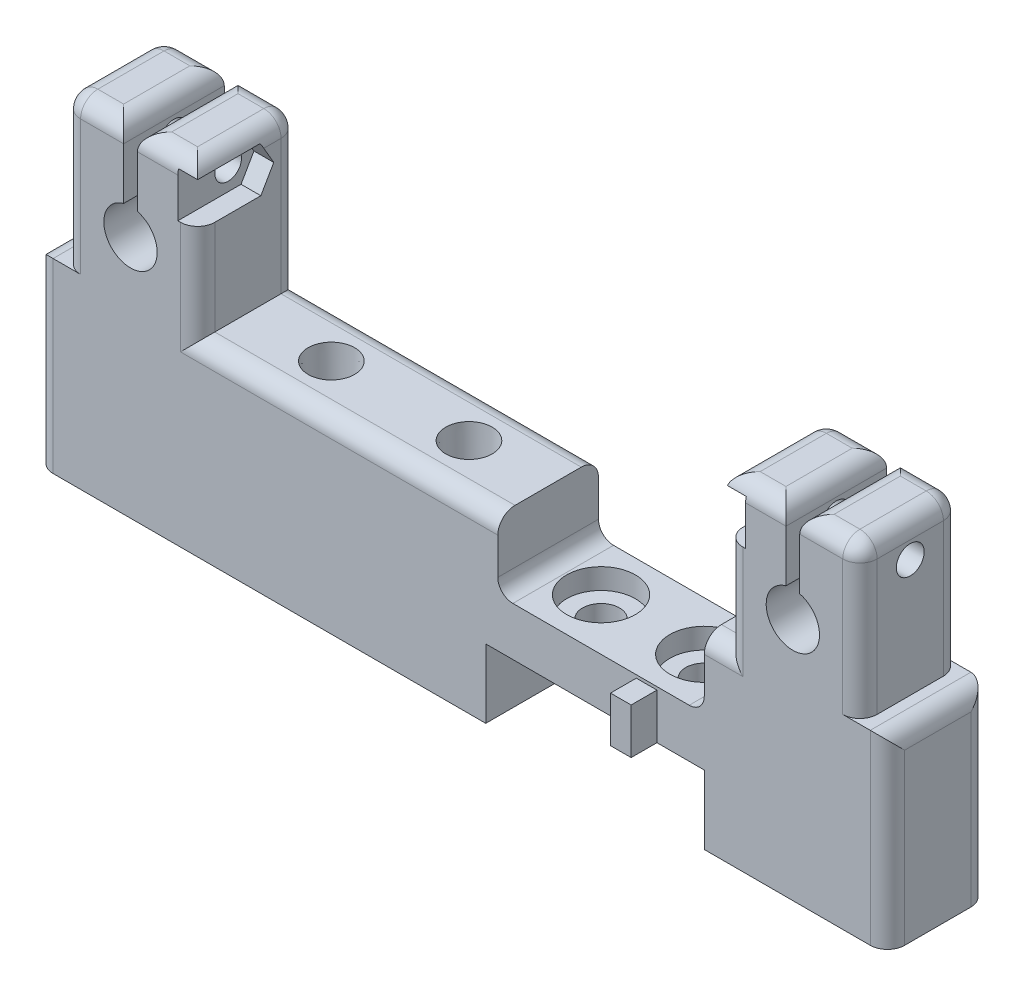
from build123d import *
from OCP.BRepFilletAPI import BRepFilletAPI_MakeChamfer
from build123d.topology import SkipClean

# Parameters (mm, degrees)
SKETCH1_R                      = 3.1
SKETCH1_R_2                    = 3.5
SKETCH1_W                      = 32
SKETCH1_H                      = 15.65
BOSS_EXTRUDE1_DEPTH            = 11.7
CUT_EXTRUDE5_DEPTH             = 14
CUT_EXTRUDE8_REACH             = 96.23
SKETCH10_R                     = 1.55
CUT_EXTRUDE8_DIRECTION_2_REACH = 96.23
CUT_EXTRUDE9_REACH             = 94.724
SKETCH11_R                     = 1.625
CUT_EXTRUDE9_DIRECTION_2_REACH = 94.724
CUT_EXTRUDE10_DEPTH            = 2.3
CUT_EXTRUDE11_DEPTH            = 2.3
HOLE1_D                        = 4.8
HOLE1_DEPTH                    = 12
HOLE1_CBORE_D                  = 5.4
HOLE1_CBORE_DEPTH              = 6
CUT_EXTRUDE17_REACH            = 66.001
SKETCH30_W                     = 59.4
SKETCH30_H                     = 25.65
SKETCH32_W                     = 99
SKETCH32_H                     = 8
CUT_EXTRUDE20_DEPTH            = 65.000566
CHAMFER1_SIZE                  = 6
CHAMFER1_SIZE_2                = 0.3
FILLET1_R                      = 2
SKETCH33_W                     = 2.4
SKETCH33_H                     = 5.3
BOSS_EXTRUDE2_DEPTH            = 3
SKETCH34_W                     = 99
SKETCH34_H                     = 8
CUT_EXTRUDE21_DEPTH            = 61.759087
CUT_EXTRUDE22_START            = -11.7
CUT_EXTRUDE22_DEPTH            = 11.7
BOSS_EXTRUDE4_DEPTH            = 8
SKETCH45_W                     = 25.4
SKETCH45_H                     = 8
CUT_EXTRUDE26_DEPTH            = 62.407383
M4_CLEARANCE_HOLE1_D           = 4.3
SKETCH46_2_R                   = 4
CUT_EXTRUDE27_DEPTH            = 2.4
FILLET5_R                      = 1.75


# Some blends are built 0.0001 mm under size
with BuildPart() as part:
    # Sketch1 → Boss-Extrude1 (new body)
    with BuildSketch(Plane.XY):
        Polygon((-43.30318, 29.275361), (25.69682, 29.275361), (55.69682, 29.275361), (55.69682, -18.024639), (-43.30318, -18.024639), align=None)
        with Locations((-32.30318, 10.275361)):
            Circle(SKETCH1_R, mode=Mode.SUBTRACT)
        with Locations((44.69682, 10.275361)):
            Circle(SKETCH1_R, mode=Mode.SUBTRACT)
        with Locations((22.69682, 12.275361)):
            Circle(SKETCH1_R_2, mode=Mode.SUBTRACT)
        with Locations((-6.80318, 11.450361)):
            Rectangle(SKETCH1_W, SKETCH1_H, mode=Mode.SUBTRACT)
    extrude(amount=-BOSS_EXTRUDE1_DEPTH)

    # Sketch7 → Cut-Extrude5 (cut)
    with BuildSketch(Plane.XY):
        with BuildLine():
            Line((-43.30318, 22.775361), (-22.50318, 22.775361))
            Line((-22.50318, 22.775361), (-22.50318, 3.625361))
            Line((-22.50318, 3.625361), (-24.50318, 3.625361))
            Line((-24.50318, 3.625361), (-24.50318, 21.275361))
            Line((-24.50318, 21.275361), (-31.50318, 21.275361))
            Line((-31.50318, 21.275361), (-31.50318, 13.270357))
            ThreePointArc((-31.50318, 13.270357), (-32.30318, 7.175361), (-33.10318, 13.270357))
            Line((-33.10318, 13.270357), (-33.10318, 21.275361))
            Line((-33.10318, 21.275361), (-40.10318, 21.275361))
            Line((-40.10318, 21.275361), (-40.10318, 3.625361))
            Line((-40.10318, 3.625361), (-43.30318, 3.625361))
            Line((-43.30318, 3.625361), (-43.30318, 22.775361))
        make_face()
        with BuildLine():
            Line((34.89682, 22.775361), (55.69682, 22.775361))
            Line((55.69682, 22.775361), (55.69682, 3.625361))
            Line((55.69682, 3.625361), (52.49682, 3.625361))
            Line((52.49682, 3.625361), (52.49682, 21.275361))
            Line((52.49682, 21.275361), (45.49682, 21.275361))
            Line((45.49682, 21.275361), (45.49682, 13.270357))
            ThreePointArc((45.49682, 13.270357), (44.69682, 7.175361), (43.89682, 13.270357))
            Line((43.89682, 13.270357), (43.89682, 21.275361))
            Line((43.89682, 21.275361), (36.89682, 21.275361))
            Line((36.89682, 21.275361), (36.89682, 3.625361))
            Line((36.89682, 3.625361), (34.89682, 3.625361))
            Line((34.89682, 3.625361), (34.89682, 22.775361))
        make_face()
    extrude(amount=-CUT_EXTRUDE5_DEPTH, mode=Mode.SUBTRACT)

    # Sketch10 → Cut-Extrude8 (cut, up to next)
    with BuildSketch(Plane(origin=(-33.10318, 0, 0), x_dir=(0, 0, -1), z_dir=(1, 0, 0)), mode=Mode.PRIVATE) as cut_extrude8_sk1:
        with Locations(Location((5.85, 17.272859, 0), (0, 0, 270))):
            Circle(SKETCH10_R)
    cut_extrude8_tool1 = extrude(cut_extrude8_sk1.sketch, amount=-CUT_EXTRUDE8_REACH, mode=Mode.PRIVATE) & part.part
    add(cut_extrude8_tool1.solids().sort_by_distance((-33.10318, 17.272859, -5.85))[0], mode=Mode.SUBTRACT)

    # Sketch10 → Cut-Extrude8 direction 2 (cut, up to next)
    with BuildSketch(Plane(origin=(-33.10318, 0, 0), x_dir=(0, 0, -1), z_dir=(1, 0, 0)), mode=Mode.PRIVATE) as cut_extrude8_direction_2_sk1:
        with Locations(Location((5.85, 17.272859, 0), (0, 0, 270))):
            Circle(SKETCH10_R)
    cut_extrude8_direction_2_tool1 = extrude(cut_extrude8_direction_2_sk1.sketch, amount=CUT_EXTRUDE8_DIRECTION_2_REACH, mode=Mode.PRIVATE) & part.part
    add(cut_extrude8_direction_2_tool1.solids().sort_by_distance((-33.10318, 17.272859, -5.85))[0], mode=Mode.SUBTRACT)

    # Sketch11 → Cut-Extrude9 (cut, up to next)
    with BuildSketch(Plane(origin=(43.89682, 0, 0), x_dir=(0, 0, -1), z_dir=(1, 0, 0)), mode=Mode.PRIVATE) as cut_extrude9_sk1:
        with Locations(Location((5.85, 17.272859, 0), (0, 0, 180))):
            Circle(SKETCH11_R)
    cut_extrude9_tool1 = extrude(cut_extrude9_sk1.sketch, amount=-CUT_EXTRUDE9_REACH, mode=Mode.PRIVATE) & part.part
    add(cut_extrude9_tool1.solids().sort_by_distance((43.89682, 17.272859, -5.85))[0], mode=Mode.SUBTRACT)

    # Sketch11 → Cut-Extrude9 direction 2 (cut, up to next)
    with BuildSketch(Plane(origin=(43.89682, 0, 0), x_dir=(0, 0, -1), z_dir=(1, 0, 0)), mode=Mode.PRIVATE) as cut_extrude9_direction_2_sk1:
        with Locations(Location((5.85, 17.272859, 0), (0, 0, 180))):
            Circle(SKETCH11_R)
    cut_extrude9_direction_2_tool1 = extrude(cut_extrude9_direction_2_sk1.sketch, amount=CUT_EXTRUDE9_DIRECTION_2_REACH, mode=Mode.PRIVATE) & part.part
    add(cut_extrude9_direction_2_tool1.solids().sort_by_distance((43.89682, 17.272859, -5.85))[0], mode=Mode.SUBTRACT)

    # Sketch12 → Cut-Extrude10 (cut)
    with BuildSketch(Plane.ZY.offset(-36.89682)):
        Polygon((-4.348889, 19.872859), (0, 19.872859), (0, 14.672859), (-4.348889, 14.672859), (-7.351111, 14.672859), (-8.852221, 17.272859), (-7.351111, 19.872859), align=None)
    extrude(amount=-CUT_EXTRUDE10_DEPTH, mode=Mode.SUBTRACT)

    # Sketch13 → Cut-Extrude11 (cut)
    with BuildSketch(Plane(origin=(-24.50318, 0, 0), x_dir=(0, 0, -1), z_dir=(1, 0, 0))):
        Polygon((4.348889, 19.872859), (0, 19.872859), (0, 14.672859), (4.348889, 14.672859), (7.351111, 14.672859), (8.852221, 17.272859), (7.351111, 19.872859), align=None)
    extrude(amount=-CUT_EXTRUDE11_DEPTH, mode=Mode.SUBTRACT)

    # Hole1
    with Locations(Plane(origin=(0, 3.625361, 0), x_dir=(1, 0, 0), z_dir=(0, 1, 0))):
        with Locations((-14.80318, 5.85), (1.19682, 5.85)):
            CounterBoreHole(HOLE1_D / 2, HOLE1_CBORE_D / 2, HOLE1_CBORE_DEPTH, depth=HOLE1_DEPTH)

    # Sketch30 → Cut-Extrude17 (cut, up to next)
    with BuildSketch(Plane(origin=(0, 0, -11.7), x_dir=(-1, 0, 0), z_dir=(0, 0, -1)), mode=Mode.PRIVATE) as cut_extrude17_sk1:
        with Locations((-5.19682, 16.450361)):
            Rectangle(SKETCH30_W, SKETCH30_H)
    cut_extrude17_tool1 = extrude(cut_extrude17_sk1.sketch, amount=-CUT_EXTRUDE17_REACH, mode=Mode.PRIVATE) & part.part
    add(cut_extrude17_tool1.solids().sort_by_distance((5.19682, 16.450361, -11.7))[0], mode=Mode.SUBTRACT)


with BuildPart() as cut_extrude17_piece_1:
    # of the separate pieces the step leaves, piece 1, a body of its own (cut_extrude17_pieces)
    add(part.part.solids().sort_by_distance((-24.50318, 3.625361, 0))[0])

    # Chamfer1
    chamfer1_edges_1 = [cut_extrude17_piece_1.edges().sort_by_distance(p)[0] for p in [
        (-1.50318, -2.374639, -5.85),
    ]]
    chamfer1_side_1 = [cut_extrude17_piece_1.faces().sort_by_distance(p)[0] for p in [
        (-1.50318, -2.368639, -5.85),
    ]]
    chamfer1_edges_2 = [cut_extrude17_piece_1.edges().sort_by_distance(p)[0] for p in [
        (-17.50318, -2.374639, -5.85),
    ]]
    chamfer1_side_2 = [cut_extrude17_piece_1.faces().sort_by_distance(p)[0] for p in [
        (-17.50318, -2.368639, -5.85),
    ]]
    chamfer1 = BRepFilletAPI_MakeChamfer(cut_extrude17_piece_1.part.solid().wrapped)
    for e in chamfer1_edges_1:
        chamfer1.Add(CHAMFER1_SIZE - 0.0001, CHAMFER1_SIZE_2 - 0.0001, e.wrapped, chamfer1_side_1[0].wrapped)
    for e in chamfer1_edges_2:
        chamfer1.Add(CHAMFER1_SIZE - 0.0001, CHAMFER1_SIZE_2 - 0.0001, e.wrapped, chamfer1_side_2[0].wrapped)
    add(Compound.cast(chamfer1.Shape()), mode=Mode.REPLACE)  # a hair under: the kernel refuses the full size

    # Fillet1
    # the kernel refuses this fillet: 2 mm, written as the material it takes off along each edge
    with BuildSketch(Plane(origin=(50.49682, 19.275361, -2), x_dir=(1, 0, 0), z_dir=(0, 1, 0))) as fillet1_piece_1_section:
        Polygon((0, 0), (FILLET1_R, 0), (FILLET1_R, -FILLET1_R), (0, -FILLET1_R), align=None)
    fillet1_piece_1 = extrude(amount=FILLET1_R, mode=Mode.PRIVATE)
    fillet1_piece_1 = fillet1_piece_1 - Plane(origin=(50.49682, 19.275361, -2), x_dir=(-0.7071067811865475, 0, -0.7071067811865475), z_dir=(0, 1, 0)) * Sphere(FILLET1_R, mode=Mode.PRIVATE)
    add(fillet1_piece_1, mode=Mode.SUBTRACT)
    with BuildSketch(Plane(origin=(50.49682, 19.275361, -9.7), x_dir=(1, 0, 0), z_dir=(0, 1, 0))) as fillet1_piece_2_section:
        Polygon((0, 0), (FILLET1_R, 0), (FILLET1_R, FILLET1_R), (0, FILLET1_R), align=None)
    fillet1_piece_2 = extrude(amount=FILLET1_R, mode=Mode.PRIVATE)
    fillet1_piece_2 = fillet1_piece_2 - Plane(origin=(50.49682, 19.275361, -9.7), x_dir=(-0.7071067811865475, 0, 0.7071067811865475), z_dir=(0, 1, 0)) * Sphere(FILLET1_R, mode=Mode.PRIVATE)
    add(fillet1_piece_2, mode=Mode.SUBTRACT)
    with BuildSketch(Plane(origin=(38.89682, 19.275361, -9.7), x_dir=(-1, 0, 0), z_dir=(0, 0, -1))) as fillet1_piece_3_section:
        Polygon((0, 0), (FILLET1_R, 0), (FILLET1_R, FILLET1_R), (0, FILLET1_R), align=None)
    fillet1_piece_3 = extrude(amount=FILLET1_R, mode=Mode.PRIVATE)
    fillet1_piece_3 = fillet1_piece_3 - Plane(origin=(38.89682, 19.275361, -9.7), x_dir=(0.7071067811865475, -0.7071067811865475, 0), z_dir=(0, 0, -1)) * Sphere(FILLET1_R, mode=Mode.PRIVATE)
    add(fillet1_piece_3, mode=Mode.SUBTRACT)
    with BuildSketch(Plane(origin=(-38.10318, 19.275361, -2), x_dir=(0, 1, 0), z_dir=(-1, 0, 0))) as fillet1_piece_4_section:
        Polygon((0, 0), (FILLET1_R, 0), (FILLET1_R, -FILLET1_R), (0, -FILLET1_R), align=None)
    fillet1_piece_4 = extrude(amount=FILLET1_R, mode=Mode.PRIVATE)
    fillet1_piece_4 = fillet1_piece_4 - Plane(origin=(-38.10318, 19.275361, -2), x_dir=(0, -0.7071067811865475, -0.7071067811865475), z_dir=(-1, 0, 0)) * Sphere(FILLET1_R, mode=Mode.PRIVATE)
    add(fillet1_piece_4, mode=Mode.SUBTRACT)
    with BuildSketch(Plane(origin=(-38.10318, 19.275361, -9.7), x_dir=(0, 1, 0), z_dir=(-1, 0, 0))) as fillet1_piece_5_section:
        Polygon((0, 0), (FILLET1_R, 0), (FILLET1_R, FILLET1_R), (0, FILLET1_R), align=None)
    fillet1_piece_5 = extrude(amount=FILLET1_R, mode=Mode.PRIVATE)
    fillet1_piece_5 = fillet1_piece_5 - Plane(origin=(-38.10318, 19.275361, -9.7), x_dir=(0, -0.7071067811865475, 0.7071067811865475), z_dir=(-1, 0, 0)) * Sphere(FILLET1_R, mode=Mode.PRIVATE)
    add(fillet1_piece_5, mode=Mode.SUBTRACT)
    with BuildSketch(Plane(origin=(-26.50318, 19.275361, -9.7), x_dir=(0, 0, -1), z_dir=(1, 0, 0))) as fillet1_piece_6_section:
        Polygon((0, 0), (FILLET1_R, 0), (FILLET1_R, FILLET1_R), (0, FILLET1_R), align=None)
    fillet1_piece_6 = extrude(amount=FILLET1_R, mode=Mode.PRIVATE)
    fillet1_piece_6 = fillet1_piece_6 - Plane(origin=(-26.50318, 19.275361, -9.7), x_dir=(0, -0.7071067811865475, 0.7071067811865475), z_dir=(1, 0, 0)) * Sphere(FILLET1_R, mode=Mode.PRIVATE)
    add(fillet1_piece_6, mode=Mode.SUBTRACT)
    with BuildSketch(Plane(origin=(52.49682, 21.275361, -2), x_dir=(-1, 0, 0), z_dir=(0, 0, -1)), Plane(origin=(-40.10318, 21.275361, -2), x_dir=(0, -1, 0), z_dir=(0, 0, -1))) as fillet1_piece_7:
        with BuildLine():
            CenterArc((FILLET1_R, -FILLET1_R), FILLET1_R, 90, 90)
            Line((0, -FILLET1_R), (0, 0))
            Line((0, 0), (FILLET1_R, 0))
        make_face()
    extrude(amount=7.7, mode=Mode.SUBTRACT)
    with BuildSketch(Plane(origin=(50.49682, 21.275361, 0), x_dir=(0, -1, 0), z_dir=(-1, 0, 0)), Plane(origin=(40.49682, 21.275361, -11.7), x_dir=(0, -1, 0), z_dir=(1, 0, 0)), Plane(origin=(38.89682, 21.275361, -11.7), x_dir=(0, -1, 0), z_dir=(1, 0, 0)), Plane(origin=(-28.10318, 21.275361, 0), x_dir=(0, -1, 0), z_dir=(-1, 0, 0)), Plane(origin=(-38.10318, 21.275361, -11.7), x_dir=(0, -1, 0), z_dir=(1, 0, 0)), Plane(origin=(-36.50318, 21.275361, -11.7), x_dir=(0, -1, 0), z_dir=(1, 0, 0))) as fillet1_piece_8:
        with BuildLine():
            CenterArc((FILLET1_R, -FILLET1_R), FILLET1_R, 90, 90)
            Line((0, -FILLET1_R), (0, 0))
            Line((0, 0), (FILLET1_R, 0))
        make_face()
    extrude(amount=10, mode=Mode.SUBTRACT)
    with BuildSketch(Plane(origin=(45.49682, 21.275361, 5), x_dir=(0, -1, 0), z_dir=(0, 0, -1)), Plane(origin=(43.89682, 21.275361, 5), x_dir=(-1, 0, 0), z_dir=(0, 0, -1)), Plane(origin=(-33.10318, 21.275361, 5), x_dir=(-1, 0, 0), z_dir=(0, 0, -1)), Plane(origin=(55.69682, 3.625361, 5), x_dir=(-1, 0, 0), z_dir=(0, 0, -1)), Plane(origin=(-43.30318, 3.625361, 5), x_dir=(0, -1, 0), z_dir=(0, 0, -1))) as fillet1_piece_9:
        with BuildLine():
            CenterArc((FILLET1_R, -FILLET1_R), FILLET1_R, 90, 90)
            Line((0, -FILLET1_R), (0, 0))
            Line((0, 0), (FILLET1_R, 0))
        make_face()
    extrude(amount=21.7, mode=Mode.SUBTRACT)
    with BuildSketch(Plane(origin=(48.89682, 21.275361, 0), x_dir=(0, -1, 0), z_dir=(-1, 0, 0)), Plane(origin=(-19.50318, 21.275361, 0), x_dir=(0, -1, 0), z_dir=(-1, 0, 0))) as fillet1_piece_10:
        with BuildLine():
            CenterArc((FILLET1_R, -FILLET1_R), FILLET1_R, 90, 90)
            Line((0, -FILLET1_R), (0, 0))
            Line((0, 0), (FILLET1_R, 0))
        make_face()
    extrude(amount=17, mode=Mode.SUBTRACT)
    with BuildSketch(Plane(origin=(36.89682, 21.275361, 5), x_dir=(0, -1, 0), z_dir=(0, 0, -1))) as fillet1_piece_11:
        with BuildLine():
            CenterArc((FILLET1_R, -FILLET1_R), FILLET1_R, 90, 90)
            Line((0, -FILLET1_R), (0, 0))
            Line((0, 0), (FILLET1_R, 0))
        make_face()
    extrude(amount=14.7, mode=Mode.SUBTRACT)
    with BuildSketch(Plane(origin=(-24.50318, 21.275361, 5), x_dir=(0, -1, 0), z_dir=(0, 0, -1))) as fillet1_piece_12:
        with BuildLine():
            CenterArc((FILLET1_R, FILLET1_R), FILLET1_R, 180, 90)
            Line((0, FILLET1_R), (0, 0))
            Line((0, 0), (FILLET1_R, 0))
        make_face()
    extrude(amount=14.7, mode=Mode.SUBTRACT)
    with BuildSketch(Plane(origin=(-31.50318, 21.275361, 5), x_dir=(1, 0, 0), z_dir=(0, 0, -1))) as fillet1_piece_13:
        with BuildLine():
            CenterArc((FILLET1_R, FILLET1_R), FILLET1_R, 180, 90)
            Line((0, FILLET1_R), (0, 0))
            Line((0, 0), (FILLET1_R, 0))
        make_face()
    extrude(amount=21.7, mode=Mode.SUBTRACT)
    with BuildSketch(Plane(origin=(55.69682, 8.625361, 0), x_dir=(-1, 0, 0), z_dir=(0, -1, 0)), Plane(origin=(-43.30318, -23.024639, 0), x_dir=(1, 0, 0), z_dir=(0, 1, 0))) as fillet1_piece_14:
        with BuildLine():
            CenterArc((FILLET1_R, FILLET1_R), FILLET1_R, 180, 90)
            Line((0, FILLET1_R), (0, 0))
            Line((0, 0), (FILLET1_R, 0))
        make_face()
    extrude(amount=31.65, mode=Mode.SUBTRACT)
    with BuildSketch(Plane(origin=(55.69682, 8.625361, -11.7), x_dir=(-1, 0, 0), z_dir=(0, -1, 0)), Plane(origin=(-43.30318, -23.024639, -11.7), x_dir=(1, 0, 0), z_dir=(0, 1, 0))) as fillet1_piece_15:
        with BuildLine():
            CenterArc((FILLET1_R, -FILLET1_R), FILLET1_R, 90, 90)
            Line((0, -FILLET1_R), (0, 0))
            Line((0, 0), (FILLET1_R, 0))
        make_face()
    extrude(amount=31.65, mode=Mode.SUBTRACT)
    with BuildSketch(Plane(origin=(36.89682, 3.625361, -11.7), x_dir=(0, 0, 1), z_dir=(-1, 0, 0))) as fillet1_piece_16:
        with BuildLine():
            CenterArc((FILLET1_R, -FILLET1_R), FILLET1_R, 90, 90)
            Line((0, -FILLET1_R), (0, 0))
            Line((0, 0), (FILLET1_R, 0))
        make_face()
    extrude(amount=61.4, mode=Mode.SUBTRACT)
    with BuildSketch(Plane(origin=(36.89682, 3.625361, 0), x_dir=(0, 0, -1), z_dir=(-1, 0, 0))) as fillet1_piece_17:
        with BuildLine():
            CenterArc((FILLET1_R, FILLET1_R), FILLET1_R, 180, 90)
            Line((0, FILLET1_R), (0, 0))
            Line((0, 0), (FILLET1_R, 0))
        make_face()
    extrude(amount=61.4, mode=Mode.SUBTRACT)
    with BuildSketch(Plane(origin=(36.89682, 19.672859, 0), x_dir=(0, 0, -1), z_dir=(0, -1, 0)), Plane(origin=(-24.50318, 3.625361, 0), x_dir=(0, 0, -1), z_dir=(0, 1, 0))) as fillet1_piece_18:
        with BuildLine():
            CenterArc((FILLET1_R, FILLET1_R), FILLET1_R, 180, 90)
            Line((0, FILLET1_R), (0, 0))
            Line((0, 0), (FILLET1_R, 0))
        make_face()
    extrude(amount=16.047498, mode=Mode.SUBTRACT)
    with BuildSketch(Plane(origin=(52.49682, 3.625361, 0), x_dir=(-1, 0, 0), z_dir=(0, 1, 0)), Plane(origin=(36.89682, 3.625361, -11.7), x_dir=(1, 0, 0), z_dir=(0, 1, 0)), Plane(origin=(52.49682, 19.275361, -11.7), x_dir=(-1, 0, 0), z_dir=(0, -1, 0)), Plane(origin=(-40.10318, 19.275361, 0), x_dir=(1, 0, 0), z_dir=(0, -1, 0)), Plane(origin=(-40.10318, 3.625361, -11.7), x_dir=(1, 0, 0), z_dir=(0, 1, 0))) as fillet1_piece_19:
        with BuildLine():
            CenterArc((FILLET1_R, -FILLET1_R), FILLET1_R, 90, 90)
            Line((0, -FILLET1_R), (0, 0))
            Line((0, 0), (FILLET1_R, 0))
        make_face()
    extrude(amount=15.65, mode=Mode.SUBTRACT)
    with BuildSketch(Plane(origin=(-24.50318, 19.275361, -11.7), x_dir=(0, 0, 1), z_dir=(0, -1, 0))) as fillet1_piece_20:
        with BuildLine():
            CenterArc((FILLET1_R, FILLET1_R), FILLET1_R, 180, 90)
            Line((0, FILLET1_R), (0, 0))
            Line((0, 0), (FILLET1_R, 0))
        make_face()
    extrude(amount=15.65, mode=Mode.SUBTRACT)
    with BuildSketch(Plane(origin=(41.89682, 3.625361, -11.7), x_dir=(0, 0, 1), z_dir=(-1, 0, 0))) as fillet1_piece_21a_section:
        with BuildLine():
            CenterArc((FILLET1_R, -FILLET1_R), FILLET1_R, 90, 90)
            Line((0, -FILLET1_R), (0, 0))
            Line((0, 0), (FILLET1_R, 0))
        make_face()
    fillet1_piece_21a = extrude(amount=66.4, mode=Mode.PRIVATE)
    fillet1_piece_21a = split(fillet1_piece_21a, bisect_by=Plane(origin=(36.89682, 3.625361, -11.7), z_dir=(1, 0, 0)), keep=Keep.TOP, mode=Mode.PRIVATE)
    with BuildSketch(Plane(origin=(36.89682, -1.374639, -11.7), x_dir=(1, 0, 0), z_dir=(0, 1, 0))) as fillet1_piece_21b_section:
        with BuildLine():
            CenterArc((FILLET1_R, -FILLET1_R), FILLET1_R, 90, 90)
            Line((0, -FILLET1_R), (0, 0))
            Line((0, 0), (FILLET1_R, 0))
        make_face()
    fillet1_piece_21b = extrude(amount=20.65, mode=Mode.PRIVATE)
    fillet1_piece_21b = split(fillet1_piece_21b, bisect_by=Plane(origin=(36.89682, 3.625361, -11.7), z_dir=(0, -1, 0)), keep=Keep.TOP, mode=Mode.PRIVATE)
    fillet1_piece_21 = fillet1_piece_21a & fillet1_piece_21b
    add(fillet1_piece_21, mode=Mode.SUBTRACT)
    with BuildSketch(Plane(origin=(36.89682, 3.625361, -11.7), x_dir=(0, 0, 1), z_dir=(-1, 0, 0))) as fillet1_piece_22a_section:
        with BuildLine():
            CenterArc((FILLET1_R, -FILLET1_R), FILLET1_R, 90, 90)
            Line((0, -FILLET1_R), (0, 0))
            Line((0, 0), (FILLET1_R, 0))
        make_face()
    fillet1_piece_22a = extrude(amount=66.4, mode=Mode.PRIVATE)
    fillet1_piece_22a = split(fillet1_piece_22a, bisect_by=Plane(origin=(-24.50318, 3.625361, -11.7), z_dir=(-1, 0, 0)), keep=Keep.TOP, mode=Mode.PRIVATE)
    with BuildSketch(Plane(origin=(-24.50318, 19.275361, -11.7), x_dir=(0, 0, 1), z_dir=(0, -1, 0))) as fillet1_piece_22b_section:
        with BuildLine():
            CenterArc((FILLET1_R, FILLET1_R), FILLET1_R, 180, 90)
            Line((0, FILLET1_R), (0, 0))
            Line((0, 0), (FILLET1_R, 0))
        make_face()
    fillet1_piece_22b = extrude(amount=20.65, mode=Mode.PRIVATE)
    fillet1_piece_22b = split(fillet1_piece_22b, bisect_by=Plane(origin=(-24.50318, 3.625361, -11.7), z_dir=(0, -1, 0)), keep=Keep.TOP, mode=Mode.PRIVATE)
    fillet1_piece_22 = fillet1_piece_22a & fillet1_piece_22b
    add(fillet1_piece_22, mode=Mode.SUBTRACT)
    with BuildSketch(Plane(origin=(41.89682, 3.625361, 0), x_dir=(0, 0, -1), z_dir=(-1, 0, 0))) as fillet1_piece_23a_section:
        with BuildLine():
            CenterArc((FILLET1_R, FILLET1_R), FILLET1_R, 180, 90)
            Line((0, FILLET1_R), (0, 0))
            Line((0, 0), (FILLET1_R, 0))
        make_face()
    fillet1_piece_23a = extrude(amount=66.4, mode=Mode.PRIVATE)
    fillet1_piece_23a = split(fillet1_piece_23a, bisect_by=Plane(origin=(36.89682, 3.625361, 0), z_dir=(1, 0, 0)), keep=Keep.TOP, mode=Mode.PRIVATE)
    with BuildSketch(Plane(origin=(36.89682, 19.672859, 0), x_dir=(0, 0, -1), z_dir=(0, -1, 0))) as fillet1_piece_23b_section:
        with BuildLine():
            CenterArc((FILLET1_R, FILLET1_R), FILLET1_R, 180, 90)
            Line((0, FILLET1_R), (0, 0))
            Line((0, 0), (FILLET1_R, 0))
        make_face()
    fillet1_piece_23b = extrude(amount=21.047498, mode=Mode.PRIVATE)
    fillet1_piece_23b = split(fillet1_piece_23b, bisect_by=Plane(origin=(36.89682, 3.625361, 0), z_dir=(0, -1, 0)), keep=Keep.TOP, mode=Mode.PRIVATE)
    fillet1_piece_23 = fillet1_piece_23a & fillet1_piece_23b
    add(fillet1_piece_23, mode=Mode.SUBTRACT)
    with BuildSketch(Plane(origin=(36.89682, 3.625361, 0), x_dir=(0, 0, -1), z_dir=(-1, 0, 0))) as fillet1_piece_24a_section:
        with BuildLine():
            CenterArc((FILLET1_R, FILLET1_R), FILLET1_R, 180, 90)
            Line((0, FILLET1_R), (0, 0))
            Line((0, 0), (FILLET1_R, 0))
        make_face()
    fillet1_piece_24a = extrude(amount=66.4, mode=Mode.PRIVATE)
    fillet1_piece_24a = split(fillet1_piece_24a, bisect_by=Plane(origin=(-24.50318, 3.625361, 0), z_dir=(-1, 0, 0)), keep=Keep.TOP, mode=Mode.PRIVATE)
    with BuildSketch(Plane(origin=(-24.50318, -1.374639, 0), x_dir=(0, 0, -1), z_dir=(0, 1, 0))) as fillet1_piece_24b_section:
        with BuildLine():
            CenterArc((FILLET1_R, FILLET1_R), FILLET1_R, 180, 90)
            Line((0, FILLET1_R), (0, 0))
            Line((0, 0), (FILLET1_R, 0))
        make_face()
    fillet1_piece_24b = extrude(amount=21.047498, mode=Mode.PRIVATE)
    fillet1_piece_24b = split(fillet1_piece_24b, bisect_by=Plane(origin=(-24.50318, 3.625361, 0), z_dir=(0, -1, 0)), keep=Keep.TOP, mode=Mode.PRIVATE)
    fillet1_piece_24 = fillet1_piece_24a & fillet1_piece_24b
    add(fillet1_piece_24, mode=Mode.SUBTRACT)

    # Sketch33 → Boss-Extrude2 (add)
    with BuildSketch(Plane.XY):
        with Locations((27.69682, -7.374639)):
            Rectangle(SKETCH33_W, SKETCH33_H)
    extrude(amount=BOSS_EXTRUDE2_DEPTH)

    # Sketch34 → Cut-Extrude21 (cut, through all)
    with BuildSketch(Plane.XY):
        with Locations((6.19682, -14.024639)):
            Rectangle(SKETCH34_W, SKETCH34_H)
    extrude(amount=-CUT_EXTRUDE21_DEPTH, mode=Mode.SUBTRACT)

    # Sketch35 → Cut-Extrude22 (cut)
    with BuildSketch(Plane.XY.offset(CUT_EXTRUDE22_START)):
        Polygon((17.39682, 3.625361), (28.359066, 3.625361), (34.39682, 3.625361), (34.39682, -4.374639), (10.39682, -4.374639), (10.39682, 1.625361), (10.39682, 3.625361), align=None)
    extrude(amount=CUT_EXTRUDE22_DEPTH, mode=Mode.SUBTRACT)

    # Sketch36 → Boss-Extrude4 (add)
    with SkipClean():  # the faces are left unmerged after this step: merging them gives an invalid solid
        with BuildSketch(Plane.XZ.offset(10.024639)):
            with BuildLine():
                Line((26.49682, 3), (26.49682, 0))
                Line((26.49682, 0), (-41.30318, 0))
                ThreePointArc((-41.30318, 0), (-42.717394, -0.585786), (-43.30318, -2))
                Line((-43.30318, -2), (-43.30318, -9.7))
                ThreePointArc((-43.30318, -9.7), (-42.717394, -11.114214), (-41.30318, -11.7))
                Line((-41.30318, -11.7), (53.69682, -11.7))
                ThreePointArc((53.69682, -11.7), (55.111033, -11.114214), (55.69682, -9.7))
                Line((55.69682, -9.7), (55.69682, -2))
                ThreePointArc((55.69682, -2), (55.111033, -0.585786), (53.69682, 0))
                Line((53.69682, 0), (28.89682, 0))
                Line((28.89682, 0), (28.89682, 3))
                Line((28.89682, 3), (26.49682, 3))
            make_face()
        extrude(amount=BOSS_EXTRUDE4_DEPTH)

    # Sketch45 → Cut-Extrude26 (cut, through all)
    with SkipClean():  # the faces are left unmerged after this step: merging them gives an invalid solid
        with BuildSketch(Plane(origin=(0, 0, -11.7), x_dir=(-1, 0, 0), z_dir=(0, 0, -1))):
            with Locations((-21.69682, -14.024639)):
                Rectangle(SKETCH45_W, SKETCH45_H)
        extrude(amount=-CUT_EXTRUDE26_DEPTH, mode=Mode.SUBTRACT)

    # M4 Clearance Hole1 (through all)
    with Locations(Plane(origin=(0, -4.374639, 0), x_dir=(1, 0, 0), z_dir=(0, 1, 0))):
        with Locations((16.39682, 6), (28.39682, 6)):
            Hole(M4_CLEARANCE_HOLE1_D / 2)

    # Sketch46<2> → Cut-Extrude27 (cut)
    with SkipClean():  # the faces are left unmerged after this step: merging them gives an invalid solid
        with BuildSketch(Plane(origin=(0, -4.374639, 0), x_dir=(1, 0, 0), z_dir=(0, 1, 0))):
            with Locations(Location((16.39682, 6, 0), (0, 0, 270))):
                Circle(SKETCH46_2_R)
            with Locations(Location((28.39682, 6, 0), (0, 0, 270))):
                Circle(SKETCH46_2_R)
        extrude(amount=-CUT_EXTRUDE27_DEPTH, mode=Mode.SUBTRACT)

    # Fillet5
    fillet5_edges = [cut_extrude17_piece_1.edges().sort_by_distance(p)[0] for p in [
        (10.39682, -4.374639, -5.85),
        (34.39682, -4.374639, -5.85),
    ]]
    fillet(fillet5_edges, radius=FILLET5_R)


with BuildPart() as cut_extrude17_piece_2:
    # of the separate pieces the step leaves, piece 2, a body of its own (cut_extrude17_pieces)
    add(part.part.solids().sort_by_distance((34.89682, 29.275361, 0))[0])


with BuildPart() as cut_extrude17_piece_3:
    # of the separate pieces the step leaves, piece 3, a body of its own (cut_extrude17_pieces)
    add(part.part.solids().sort_by_distance((-43.30318, 29.275361, 0))[0])


with BuildPart() as cut_extrude20_tool:
    # Sketch32 → Cut-Extrude20 (new, through all)
    with BuildSketch(Plane(origin=(0, 0, -11.7), x_dir=(-1, 0, 0), z_dir=(0, 0, -1))):
        with Locations((-6.19682, 25.275361)):
            Rectangle(SKETCH32_W, SKETCH32_H)
    extrude(amount=-CUT_EXTRUDE20_DEPTH)


with BuildPart() as cut_extrude17_piece_2_1:
    add(cut_extrude17_piece_2.part)

    # Cut-Extrude20: cut by cut_extrude20_tool
    add(cut_extrude20_tool.part, mode=Mode.SUBTRACT)


with BuildPart() as cut_extrude17_piece_3_1:
    add(cut_extrude17_piece_3.part)

    # Cut-Extrude20: cut by cut_extrude20_tool
    add(cut_extrude20_tool.part, mode=Mode.SUBTRACT)


solid = cut_extrude17_piece_1.part
